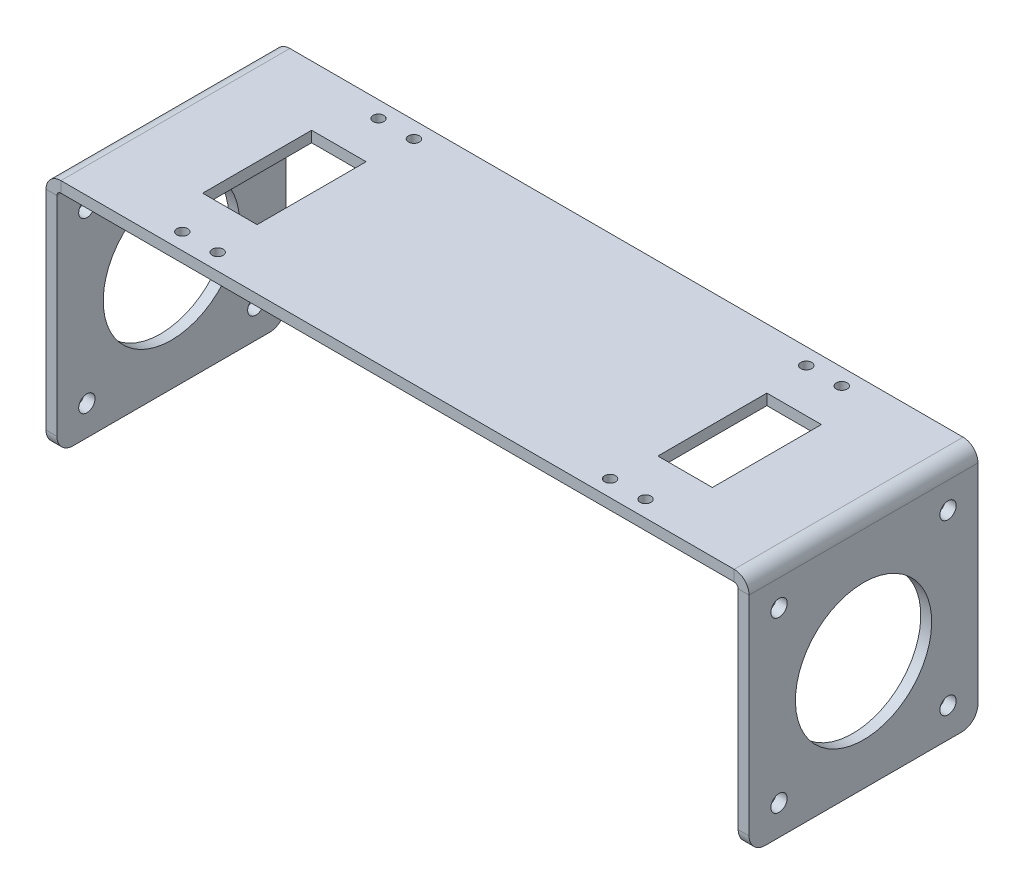
from build123d import *

# Parameters (mm, degrees)
SKETCH_1_W                         = 125
SKETCH_1_H                         = 42
SM_BASE_FLANGE_490_DEPTH           = 2
SM_EDGE_FLANGE_503_STRIP_W         = 9.4732
SM_EDGE_FLANGE_503_STRIP_H         = 2
SM_EDGE_FLANGE_503_STRIP_CUT_DEPTH = 42
SM_EDGE_FLANGE_503_DEPTH           = 42
SM_EDGE_FLANGE_662_STRIP_W         = 9.4732
SM_EDGE_FLANGE_662_STRIP_H         = 2
SM_EDGE_FLANGE_662_STRIP_CUT_DEPTH = 42
SM_EDGE_FLANGE_662_DEPTH           = 42
FILLET_810_R                       = 3
EXTRUDE_START                      = -129
EXTRUDE_1524_OUTLINE_R             = 1.5
EXTRUDE_1524_OUTLINE_R_2           = 12.5
EXTRUDE_1524_DEPTH                 = 129
EXTRUDE_START_2                    = -2
EXTRUDE_2057_OUTLINE_W             = 10
EXTRUDE_2057_OUTLINE_H             = 20
EXTRUDE_2057_DEPTH                 = 2
HOLE_WIZARD_M2_D                   = 2


# Read off the part's stored shape, not the designer's step: 电机螺丝孔, 车架接口
# Sheet-metal steps are written as plain solids
with BuildPart() as part:
    # Sketch 1 → Sm Base Flange 490 (new body)
    with BuildSketch(Plane(origin=(0, 0, 0), x_dir=(1, 0, 0), z_dir=(0, 1, 0))):
        with Locations((6.143518865, -7.014413587)):
            Rectangle(SKETCH_1_W, SKETCH_1_H)
    extrude(amount=-SM_BASE_FLANGE_490_DEPTH)

    # Sm Edge Flange 503 strip (across the edge) → Sm Edge Flange 503 strip cut (cut)
    with BuildSketch(Plane(origin=(-56.356481135, -2, 28.014413587), x_dir=(1, 0, 0), z_dir=(0, 0, -1))):
        with Locations((-4, -1)):
            Rectangle(SM_EDGE_FLANGE_503_STRIP_W, SM_EDGE_FLANGE_503_STRIP_H)
    extrude(amount=SM_EDGE_FLANGE_503_STRIP_CUT_DEPTH, mode=Mode.SUBTRACT)

    # Sm Edge Flange 503 section (across the edge) → Sm Edge Flange 503 (add)
    with BuildSketch(Plane(origin=(-56.356481135, -2, 28.014413587), x_dir=(1, 0, 0), z_dir=(0, 0, -1))):
        with BuildLine():
            Line((-2, 0.7366), (-2, 42))
            Line((-2, 42), (0, 42))
            Line((0, 42), (0, 0.7366))
            ThreePointArc((0, 0.7366), (0.215745145, 0.215745145), (0.7366, 0))
            Line((0.7366, 0), (0.7366, -2))
            ThreePointArc((0.7366, -2), (-1.198468417, -1.198468417), (-2, 0.7366))
        make_face()
    extrude(amount=SM_EDGE_FLANGE_503_DEPTH)

    # Sm Edge Flange 662 strip (across the edge) → Sm Edge Flange 662 strip cut (cut)
    with BuildSketch(Plane(origin=(68.643518865, -2, -13.985586413), x_dir=(-1, 0, 0), z_dir=(0, 0, 1))):
        with Locations((-4, -1)):
            Rectangle(SM_EDGE_FLANGE_662_STRIP_W, SM_EDGE_FLANGE_662_STRIP_H)
    extrude(amount=SM_EDGE_FLANGE_662_STRIP_CUT_DEPTH, mode=Mode.SUBTRACT)

    # Sm Edge Flange 662 section (across the edge) → Sm Edge Flange 662 (add)
    with BuildSketch(Plane(origin=(68.643518865, -2, -13.985586413), x_dir=(-1, 0, 0), z_dir=(0, 0, 1))):
        with BuildLine():
            Line((-2, 0.7366), (-2, 42))
            Line((-2, 42), (0, 42))
            Line((0, 42), (0, 0.7366))
            ThreePointArc((0, 0.7366), (0.215745145, 0.215745145), (0.7366, 0))
            Line((0.7366, 0), (0.7366, -2))
            ThreePointArc((0.7366, -2), (-1.198468417, -1.198468417), (-2, 0.7366))
        make_face()
    extrude(amount=SM_EDGE_FLANGE_662_DEPTH)

    # Fillet 810
    fillet_810_edges = [part.edges().sort_by_distance(p)[0] for p in [
        (-57.356481135, -44, 28.014413587),
        (-57.356481135, -44, -13.985586413),
        (69.643518865, -44, -13.985586413),
        (69.643518865, -44, 28.014413587),
    ]]
    fillet(fillet_810_edges, radius=FILLET_810_R)

    # Extrude 1524 outline → Extrude 1524 (cut)
    with BuildSketch(Plane.ZY.offset(58.356481135).offset(EXTRUDE_START)):
        with Locations((-8.485586413, -7.5)):
            Circle(EXTRUDE_1524_OUTLINE_R)
        with Locations((22.514413587, -7.5)):
            Circle(EXTRUDE_1524_OUTLINE_R)
        with Locations((22.514413587, -38.5)):
            Circle(EXTRUDE_1524_OUTLINE_R)
        with Locations((-8.485586413, -38.5)):
            Circle(EXTRUDE_1524_OUTLINE_R)
        with Locations((7.014413587, -23.7366)):
            Circle(EXTRUDE_1524_OUTLINE_R_2)
    extrude(amount=EXTRUDE_1524_DEPTH, mode=Mode.SUBTRACT)

    # Extrude 2057 outline → Extrude 2057 (cut)
    with BuildSketch(Plane(origin=(0, 0, 0), x_dir=(1, 0, 0), z_dir=(0, 1, 0)).offset(EXTRUDE_START_2)):
        with Locations((47.906918865, -7.014413587)):
            Rectangle(EXTRUDE_2057_OUTLINE_W, EXTRUDE_2057_OUTLINE_H)
        with Locations((-35.619881135, -7.014413587)):
            Rectangle(EXTRUDE_2057_OUTLINE_W, EXTRUDE_2057_OUTLINE_H)
    extrude(amount=EXTRUDE_2057_DEPTH, mode=Mode.SUBTRACT)

    # M2螺纹孔 (through all)
    with Locations(Plane(origin=(0, 0, 0), x_dir=(1, 0, 0), z_dir=(0, 1, 0))):
        with Locations((-29.854881135, 10.985586413), (42.141918865, 10.985586413), (42.141918865, -25.014413587), (-29.854881135, -25.014413587), (-36.354881135, 10.985586413), (48.641918865, 10.985586413), (48.641918865, -25.014413587), (-36.354881135, -25.014413587)):
            Hole(HOLE_WIZARD_M2_D / 2)


solid = part.part
